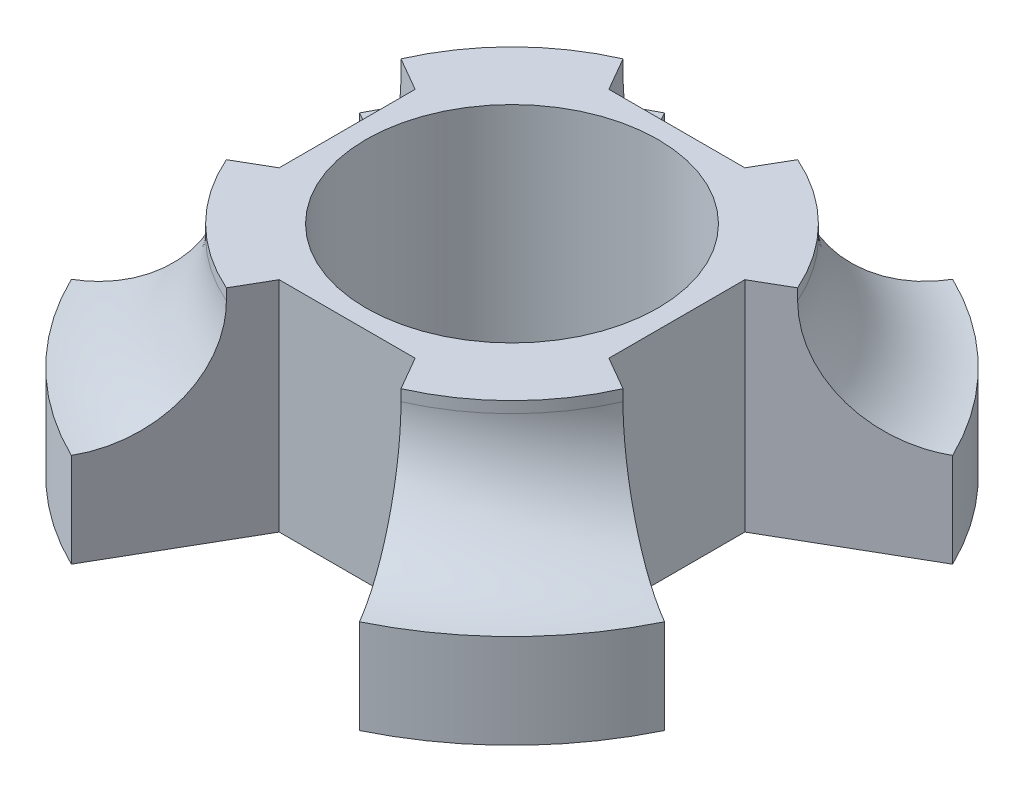
from build123d import *

# Parameters (mm, degrees)
SKETCH1_R           = 11.5
SKETCH1_R_2         = 7.75
BOSS_EXTRUDE1_DEPTH = 11.4
SKETCH2_R           = 11.5
SKETCH2_R_2         = 7.75
BOSS_EXTRUDE2_DEPTH = 0.2
SKETCH5_R           = 17.5
SKETCH5_R_2         = 7.75
BOSS_EXTRUDE3_DEPTH = 5
FILLET1_R           = 6
CUT_EXTRUDE2_DEPTH  = 28.332398358
CIRPATTERN1_COUNT   = 4


with BuildPart() as part:
    # Sketch1 → Boss-Extrude1 (new body)
    with BuildSketch(Plane(origin=(0, 0, 0), x_dir=(1, 0, 0), z_dir=(0, 1, 0))):
        with Locations(Location((0, 0, 0), (0, 0, 270))):
            Circle(SKETCH1_R)
        with Locations(Location((0, 0, 0), (0, 0, 270))):
            Circle(SKETCH1_R_2, mode=Mode.SUBTRACT)
    extrude(amount=BOSS_EXTRUDE1_DEPTH)

    # Sketch2 → Boss-Extrude2 (add)
    with BuildSketch(Plane(origin=(0, 11.4, 0), x_dir=(1, 0, 0), z_dir=(0, 1, 0))):
        with Locations(Location((0, 0, 0), (0, 0, 270))):
            Circle(SKETCH2_R)
        with Locations(Location((0, 0, 0), (0, 0, 270))):
            Circle(SKETCH2_R_2, mode=Mode.SUBTRACT)
    extrude(amount=BOSS_EXTRUDE2_DEPTH)

    # Sketch5 → Boss-Extrude3 (add)
    with BuildSketch(Plane(origin=(0, 0, 0), x_dir=(1, 0, 0), z_dir=(0, 1, 0))):
        with Locations(Location((0, 0, 0), (0, 0, 270))):
            Circle(SKETCH5_R)
        with Locations(Location((0, 0, 0), (0, 0, 270))):
            Circle(SKETCH5_R_2, mode=Mode.SUBTRACT)
    extrude(amount=BOSS_EXTRUDE3_DEPTH)

    # Fillet1
    fillet1_edges = [part.edges().sort_by_distance(p)[0] for p in [
        (0, 5, -11.5),
    ]]
    fillet(fillet1_edges, radius=FILLET1_R - 0.0001)  # a hair under: the kernel refuses the full size

    # Sketch6 → Cut-Extrude2 (cut, through all)
    with BuildSketch(Plane(origin=(0, 11.6, 0), x_dir=(1, 0, 0), z_dir=(0, 1, 0))):
        Polygon((3.608439182, 21.25), (-3.608439182, 21.25), (-7.645118273, 15.741733278), (-7.216878365, 15), (-3.608439182, 8.75), (3.608439182, 8.75), (7.216878365, 15), (7.645118273, 15.741733278), align=None)
    cut_extrude2 = extrude(amount=-CUT_EXTRUDE2_DEPTH, mode=Mode.SUBTRACT)

    # CirPattern1: Cut-Extrude2 ×4 about axis
    cirpattern1_axis = Axis((0, 0, 0), (0, 1, 0))
    for i in range(1, CIRPATTERN1_COUNT):
        add(cut_extrude2.rotate(cirpattern1_axis, i * 360 / CIRPATTERN1_COUNT), mode=Mode.SUBTRACT)


solid = part.part
